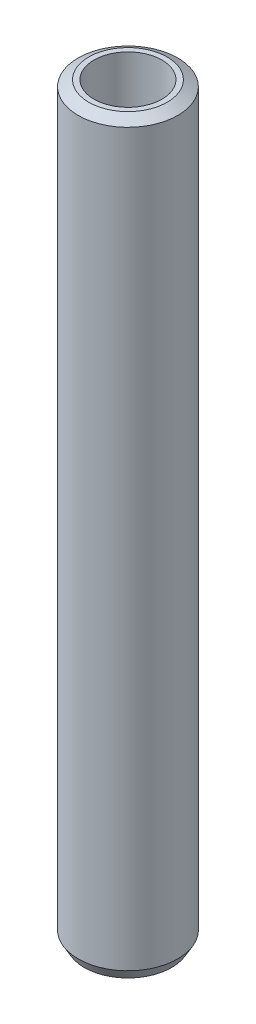
from build123d import *
from OCP.BRepFilletAPI import BRepFilletAPI_MakeChamfer

# Parameters (mm, degrees)
SKETCH1_R           = 40
BOSS_EXTRUDE1_DEPTH = 600
SKETCH2_R           = 27.285725891
CUT_EXTRUDE1_DEPTH  = 603.660766933
CHAMFER1_SIZE       = 4.90676859
CHAMFER1_SIZE2      = 8.4987725


with BuildPart() as part:
    # Sketch1 → Boss-Extrude1 (new body)
    with BuildSketch(Plane(origin=(0, 0, 0), x_dir=(1, 0, 0), z_dir=(0, 1, 0))):
        Circle(SKETCH1_R)
    extrude(amount=BOSS_EXTRUDE1_DEPTH)

    # Sketch2 → Cut-Extrude1 (cut, through all)
    with BuildSketch(Plane(origin=(0, 0, 0), x_dir=(1, 0, 0), z_dir=(0, 1, 0))):
        Circle(SKETCH2_R)
    extrude(amount=CUT_EXTRUDE1_DEPTH, mode=Mode.SUBTRACT)

    # Chamfer1: one chamfer whose edges measure the first distance from different faces: ONE call of the kernel's chamfer builder (chamfer() names one face for all edges)
    chamfer1_edges_1 = [part.edges().sort_by_distance(p)[0] for p in [
        (-40, 600, 0),
    ]]
    chamfer1_side_1 = [part.faces().sort_by_distance(p)[0] for p in [
        (-40, 300, 0),
    ]]
    chamfer1_edges_2 = [part.edges().sort_by_distance(p)[0] for p in [
        (-40, 0, 0),
    ]]
    chamfer1_side_2 = [part.faces().sort_by_distance(p)[0] for p in [
        (-38.86862915, 0, 0),
    ]]
    chamfer1 = BRepFilletAPI_MakeChamfer(part.part.solid().wrapped)
    for e in chamfer1_edges_1:
        chamfer1.Add(CHAMFER1_SIZE, CHAMFER1_SIZE2, e.wrapped, chamfer1_side_1[0].wrapped)  # the first distance lies on this face
    for e in chamfer1_edges_2:
        chamfer1.Add(CHAMFER1_SIZE, CHAMFER1_SIZE2, e.wrapped, chamfer1_side_2[0].wrapped)  # the first distance lies on this face
    add(Compound.cast(chamfer1.Shape()), mode=Mode.REPLACE)


solid = part.part
